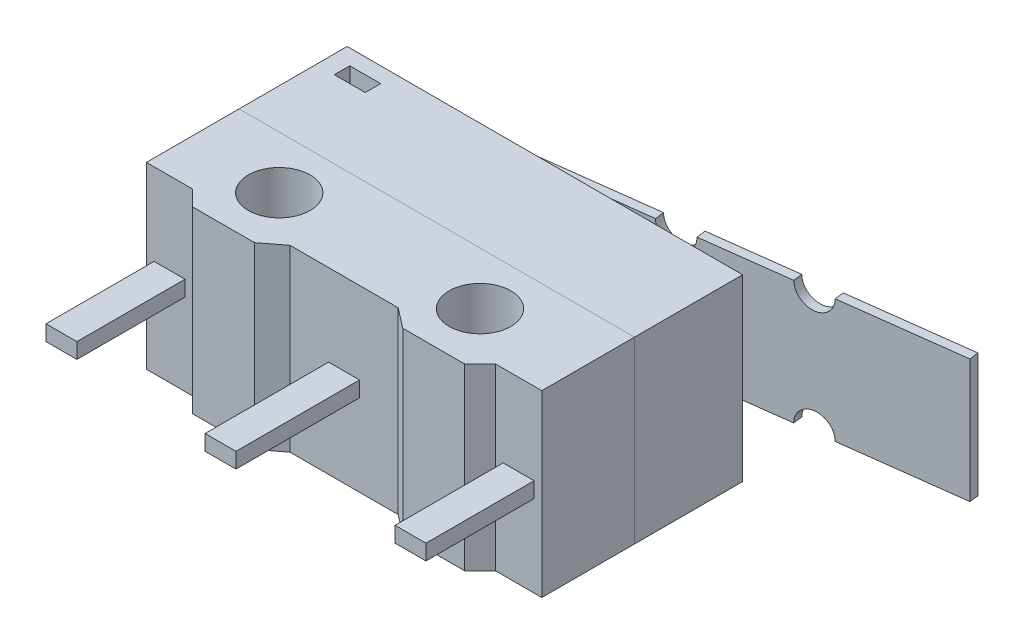
from build123d import *

# Parameters (mm, degrees)
SKETCH_1_W            = 12.8
SKETCH_1_H            = 5.8
EXTRUDE_1_DEPTH       = 3.5
SKETCH_2_W            = 1
SKETCH_2_H            = 2.9
EXTRUDE_2_DEPTH       = 1.05
FILLET_1_R            = 0.5
SKETCH_3_W            = 1
SKETCH_3_H            = 4
CUT_EXTRUDE_1_DEPTH   = 1
SKETCH_4_W            = 1
SKETCH_4_H            = 0.5
CUT_EXTRUDE_2_DEPTH   = 10.31933474
EXTRUDE_110_DEPTH     = 5.8
SKETCH_6_W            = 1
SKETCH_6_H            = 0.5
EXTRUDE_3_DEPTH       = 4
SKETCH_5_W            = 1
SKETCH_5_H            = 0.5
EXTRUDE_210_DEPTH     = 3.5
SKETCH_7_R            = 1
CUT_EXTRUDE_110_DEPTH = 17.293966082
EXTRUDE_212_DEPTH     = 0.3


with BuildPart() as part:
    # Эскиз1 → Вытянуть1 (new body)
    with BuildSketch(Plane.XY):
        Rectangle(SKETCH_1_W, SKETCH_1_H)
    extrude(amount=EXTRUDE_1_DEPTH)

    # Эскиз2 → Вытянуть2 (add)
    with BuildSketch(Plane(origin=(0, 0, 0), x_dir=(-1, 0, 0), z_dir=(0, 0, -1))):
        with Locations((-2.4, 0)):
            Rectangle(SKETCH_2_W, SKETCH_2_H)
    extrude(amount=EXTRUDE_2_DEPTH)

    # Скругление1
    fillet_1_edges = [part.edges().sort_by_distance(p)[0] for p in [
        (2.9, 0, -1.05),
        (1.9, 0, -1.05),
    ]]
    fillet(fillet_1_edges, radius=FILLET_1_R - 0.0001)  # a hair under: the kernel refuses the full size

    # Эскиз3 → Вырез-Вытянуть1 (cut)
    with BuildSketch(Plane(origin=(0, 0, 0), x_dir=(-1, 0, 0), z_dir=(0, 0, -1))):
        with Locations((5.31562156, 0)):
            Rectangle(SKETCH_3_W, SKETCH_3_H)
    extrude(amount=-CUT_EXTRUDE_1_DEPTH, mode=Mode.SUBTRACT)

    # Эскиз4 → Вырез-Вытянуть2 (cut, through all)
    with BuildSketch(Plane.XZ.offset(2.9)):
        with Locations((-5.31562156, 0.75)):
            Rectangle(SKETCH_4_W, SKETCH_4_H)
    extrude(amount=-CUT_EXTRUDE_2_DEPTH, mode=Mode.SUBTRACT)


with BuildPart() as body_2:
    # Эскиз110 → Вытянуть110 (new body)
    with BuildSketch(Plane(origin=(1.592474691, 2.9, -4.760466002), x_dir=(1, 0, 0), z_dir=(0, -1, 0))):
        Polygon((-7.992474691, 8.260466002), (4.807525309, 8.260466002), (4.807525309, 11.260466002), (3.307525309, 11.260466002), (2.807525309, 11.760466002), (0.807525309, 11.760466002), (0.157525309, 11.260466002), (-3.342474691, 11.260466002), (-3.992474691, 11.760466002), (-5.992474691, 11.760466002), (-6.492474691, 11.260466002), (-7.992474691, 11.260466002), align=None)
    extrude(amount=EXTRUDE_110_DEPTH)

    # Эскиз6 → Вытянуть3 (add)
    with BuildSketch(Plane(origin=(-1.592474691, 3.5, 6.5), x_dir=(1, 0, 0), z_dir=(0, 0, 1))):
        with Locations((1.592474691, -3.5)):
            Rectangle(SKETCH_6_W, SKETCH_6_H)
    extrude(amount=EXTRUDE_3_DEPTH)

    # Эскиз5 → Вытянуть210 (add)
    with BuildSketch(Plane(origin=(-1.592474691, 3.5, 6.5), x_dir=(1, 0, 0), z_dir=(0, 0, 1))):
        with Locations((-4.057525309, -3.5)):
            Rectangle(SKETCH_5_W, SKETCH_5_H)
        with Locations((7.242474691, -3.5)):
            Rectangle(SKETCH_5_W, SKETCH_5_H)
    extrude(amount=EXTRUDE_210_DEPTH)

    # Эскиз7 → Вырез-Вытянуть110 (cut, through all)
    with BuildSketch(Plane(origin=(1.592474691, 2.9, -2.460466002), x_dir=(-1, 0, 0), z_dir=(0, 1, 0))):
        with Locations(Location((-1.507525309, 7.660466002, 0), (0, 0, 90))):
            Circle(SKETCH_7_R)
        with Locations(Location((4.992474691, 7.660466002, 0), (0, 0, 90))):
            Circle(SKETCH_7_R)
    extrude(amount=-CUT_EXTRUDE_110_DEPTH, mode=Mode.SUBTRACT)


with BuildPart() as body_3:
    # Эскиз111 → Вытянуть212 (new body)
    with BuildSketch(Plane(origin=(-0.093466794, 0, -0.731321722), x_dir=(-0.9919316118223265, 0, 0.1267741198650638), z_dir=(-0.12677411986506376, 0, -0.9919316118223264))):
        with BuildLine():
            Line((5.768698868, -0.5), (-2.231301132, -0.5))
            Line((-2.231301132, -0.5), (-2.231301132, 0.5))
            Line((-2.231301132, 0.5), (5.768698868, 0.5))
            Line((5.768698868, 0.5), (5.768698868, 2))
            Line((5.768698868, 2), (-2.631301132, 2))
            ThreePointArc((-2.631301132, 2), (-3.231301132, 1.4), (-3.831301132, 2))
            Line((-3.831301132, 2), (-6.631301132, 2))
            ThreePointArc((-6.631301132, 2), (-7.231301132, 1.4), (-7.831301132, 2))
            Line((-7.831301132, 2), (-11.731301132, 2))
            Line((-11.731301132, 2), (-11.731301132, -2))
            Line((-11.731301132, -2), (-7.831301132, -2))
            ThreePointArc((-7.831301132, -2), (-7.231301132, -1.4), (-6.631301132, -2))
            Line((-6.631301132, -2), (-3.831301132, -2))
            ThreePointArc((-3.831301132, -2), (-3.231301132, -1.4), (-2.631301132, -2))
            Line((-2.631301132, -2), (5.768698868, -2))
            Line((5.768698868, -2), (5.768698868, -0.5))
        make_face()
    extrude(amount=EXTRUDE_212_DEPTH)


solid = Compound([part.part, body_2.part, body_3.part])
